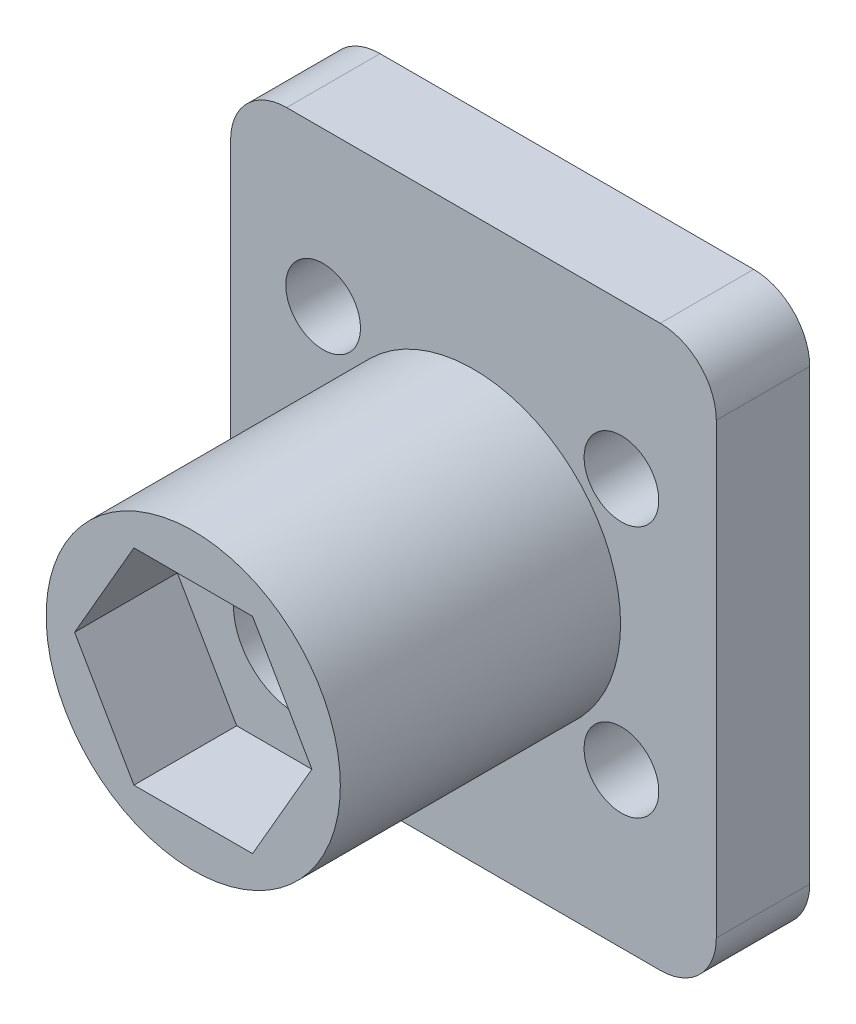
from build123d import *

# Parameters (mm, degrees)
ESQUISSE1_R             = 7.875
BOSS_EXTRU_1_DEPTH      = 15
ESQUISSE2_W             = 26
ESQUISSE2_H             = 30
BOSS_EXTRU_2_DEPTH      = 5
ESQUISSE3_R             = 3.35
BOSS_EXTRU_3_DEPTH      = 9.5
ENL_V_START             = -19.5
ESQUISSE4_R             = 3.35
ENL_V_MAT_EXTRU_1_DEPTH = 19.5
ESQUISSE5_R             = 2
ENL_V_MAT_EXTRU_2_DEPTH = 9.5
CONG_1_R                = 3


with BuildPart() as part:
    # Esquisse1 → Boss.-Extru.1 (new body)
    with BuildSketch(Plane.XY):
        Circle(ESQUISSE1_R)
        Polygon((6.350852961, 0), (3.175426481, 5.5), (-3.175426481, 5.5), (-6.350852961, 0), (-3.175426481, -5.5), (3.175426481, -5.5), align=None, mode=Mode.SUBTRACT)
    extrude(amount=BOSS_EXTRU_1_DEPTH)

    # Esquisse2 → Boss.-Extru.2 (add)
    with BuildSketch(Plane(origin=(0, 0, 0), x_dir=(-1, 0, 0), z_dir=(0, 0, -1))):
        Rectangle(ESQUISSE2_W, ESQUISSE2_H)
    extrude(amount=BOSS_EXTRU_2_DEPTH)

    # Esquisse3 → Boss.-Extru.3 (add)
    with BuildSketch(Plane.XY):
        Polygon((-3.175426481, -5.5), (3.175426481, -5.5), (6.350852961, 0), (3.175426481, 5.5), (-3.175426481, 5.5), (-6.350852961, 0), align=None)
        Circle(ESQUISSE3_R, mode=Mode.SUBTRACT)
    extrude(amount=BOSS_EXTRU_3_DEPTH)

    # Esquisse4 → Enlèv. mat.-Extru.1 (cut)
    with BuildSketch(Plane.XY.offset(9.5).offset(ENL_V_START)):
        Circle(ESQUISSE4_R)
    extrude(amount=ENL_V_MAT_EXTRU_1_DEPTH, mode=Mode.SUBTRACT)

    # Esquisse5 → Enlèv. mat.-Extru.2 (cut)
    with BuildSketch(Plane(origin=(0, 0, -5), x_dir=(-1, 0, 0), z_dir=(0, 0, -1))):
        with Locations((-7.921749048, 6.75)):
            Circle(ESQUISSE5_R)
        with Locations((8.047491096, 6.75)):
            Circle(ESQUISSE5_R)
        with Locations((-7.921749048, -6.75)):
            Circle(ESQUISSE5_R)
        with Locations((8.047491096, -6.75)):
            Circle(ESQUISSE5_R)
    extrude(amount=-ENL_V_MAT_EXTRU_2_DEPTH, mode=Mode.SUBTRACT)

    # Congé1
    cong_1_edges = [part.edges().sort_by_distance(p)[0] for p in [
        (13, 15, -2.5),
        (-13, -15, -2.5),
        (-13, 15, -2.5),
        (13, -15, -2.5),
    ]]
    fillet(cong_1_edges, radius=CONG_1_R)


solid = part.part
